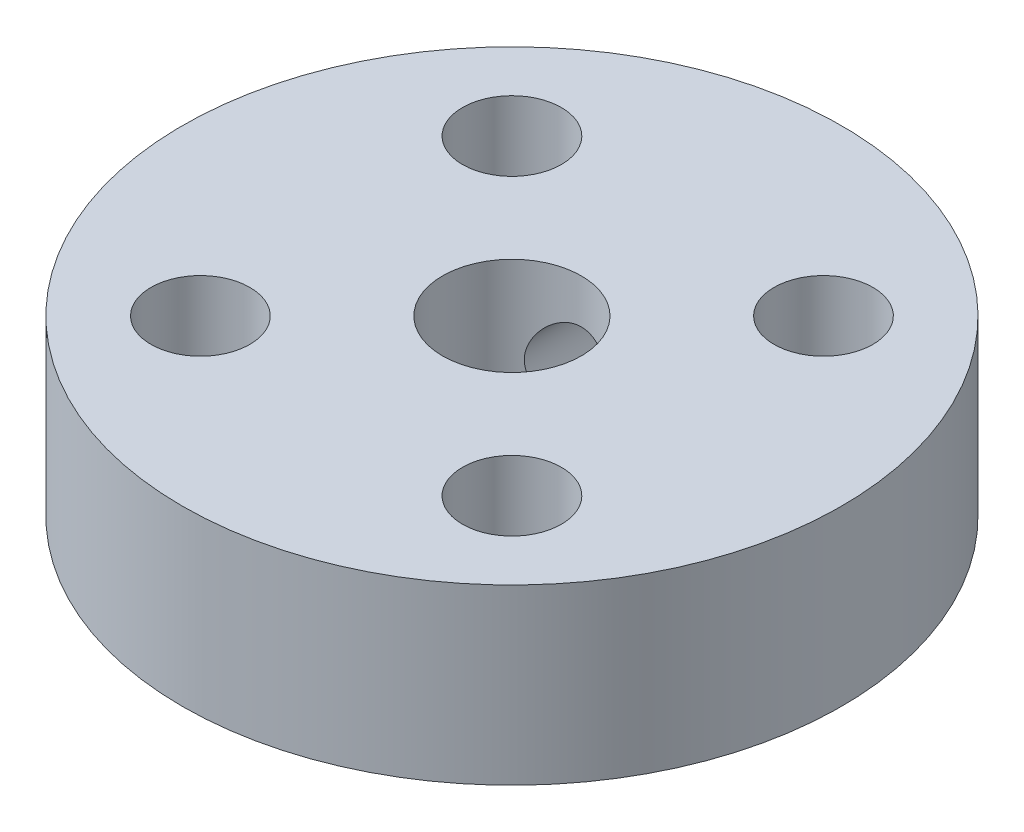
from build123d import *

# Parameters (mm, degrees)
SKETCH1_R           = 9.5
SKETCH1_R_2         = 2
SKETCH1_R_3         = 1.425
BOSS_EXTRUDE1_DEPTH = 5
CUT_EXTRUDE1_REACH  = 23.823
SKETCH2_R           = 1.225


with BuildPart() as part:
    # Sketch1 → Boss-Extrude1 (new body)
    with BuildSketch(Plane(origin=(0, 0, 0), x_dir=(1, 0, 0), z_dir=(0, 1, 0))):
        Circle(SKETCH1_R)
        Circle(SKETCH1_R_2, mode=Mode.SUBTRACT)
        with Locations((-4.490128061, 4.490128061)):
            Circle(SKETCH1_R_3, mode=Mode.SUBTRACT)
        with Locations((4.490128061, 4.490128061)):
            Circle(SKETCH1_R_3, mode=Mode.SUBTRACT)
        with Locations((4.490128061, -4.490128061)):
            Circle(SKETCH1_R_3, mode=Mode.SUBTRACT)
        with Locations((-4.490128061, -4.490128061)):
            Circle(SKETCH1_R_3, mode=Mode.SUBTRACT)
    extrude(amount=BOSS_EXTRUDE1_DEPTH)

    # Sketch2 → Cut-Extrude1 (cut, up to next)
    with BuildSketch(Plane(origin=(0, 0, -9.5), x_dir=(-1, 0, 0), z_dir=(0, 0, -1)), mode=Mode.PRIVATE) as cut_extrude1_sk1:
        with Locations((0, 2.5)):
            Circle(SKETCH2_R)
    cut_extrude1_tool1 = extrude(cut_extrude1_sk1.sketch, amount=-CUT_EXTRUDE1_REACH, mode=Mode.PRIVATE) & part.part
    add(cut_extrude1_tool1.solids().sort_by_distance((0, 2.5, -9.5))[0], mode=Mode.SUBTRACT)


solid = part.part
